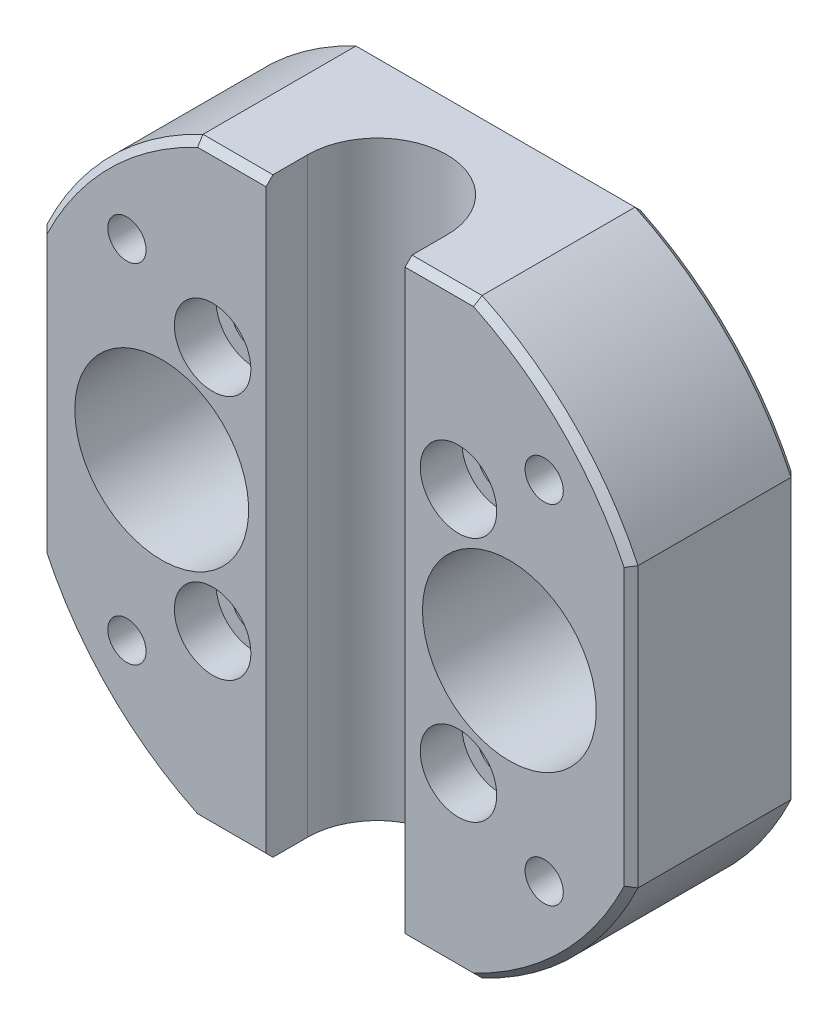
from build123d import *

# Parameters (mm, degrees)
SKETCH1_W                        = 70
SKETCH1_H                        = 50
BOSS_EXTRUDE1_DEPTH              = 12
SKETCH4_R                        = 47
BOSS_EXTRUDE2_DEPTH              = 24
SKETCH2_R                        = 31.5
CUT_EXTRUDE1_DEPTH               = 6
CBORE_START                      = -6
CBORE_FOR_M6_SHCS1_OUTLINE_R     = 3.3
CBORE_FOR_M6_SHCS1_DEPTH         = 18
CBORE_START_2                    = 6
CBORE_FOR_M6_SHCS1_2_OUTLINE_R   = 5.5
CBORE_FOR_M6_SHCS1_2_OUTLINE_R_2 = 3.3
CBORE_FOR_M6_SHCS1_2_DEPTH       = 6
CUT_EXTRUDE6_DEPTH               = 68.542579163
CUT_EXTRUDE6_DEPTH_BACK          = 68.542579163
M5_CLEARANCE_HOLE2_D             = 5.5
F_6_0MM_PRESS_DOWEL_HOLE2_D      = 6
SKETCH22_R                       = 12.5
CUT_EXTRUDE7_DEPTH               = 71.668239144
CUT_EXTRUDE8_DEPTH               = 10
CUT_EXTRUDE9_DEPTH               = 71.668239144
CHAMFER2_SIZE                    = 1


# Read off the part's stored shape, not the designer's step: CBORE for M6 SHCS1
with BuildPart() as part:
    # Sketch1 → Boss-Extrude1 (new, symmetric)
    with BuildSketch(Plane.XY):
        Rectangle(SKETCH1_W, SKETCH1_H)
    extrude(amount=BOSS_EXTRUDE1_DEPTH, both=True)

    # Sketch4 → Boss-Extrude2 (add, through all)
    with BuildSketch(Plane(origin=(0, 0, -12), x_dir=(-1, 0, 0), z_dir=(0, 0, -1))):
        Circle(SKETCH4_R)
    extrude(amount=-BOSS_EXTRUDE2_DEPTH)

    # Sketch2 → Cut-Extrude1 (cut)
    with BuildSketch(Plane(origin=(0, 0, -12), x_dir=(-1, 0, 0), z_dir=(0, 0, -1))):
        Circle(SKETCH2_R)
    extrude(amount=-CUT_EXTRUDE1_DEPTH, mode=Mode.SUBTRACT)

    # CBORE for M6 SHCS1 outline → CBORE for M6 SHCS1 (cut)
    with BuildSketch(Plane.XY.offset(CBORE_START)):
        with Locations((-17.67766953, -17.67766953)):
            Circle(CBORE_FOR_M6_SHCS1_OUTLINE_R)
        with Locations((-17.67766953, 17.67766953)):
            Circle(CBORE_FOR_M6_SHCS1_OUTLINE_R)
        with Locations((17.67766953, 17.67766953)):
            Circle(CBORE_FOR_M6_SHCS1_OUTLINE_R)
        with Locations((17.67766953, -17.67766953)):
            Circle(CBORE_FOR_M6_SHCS1_OUTLINE_R)
    extrude(amount=CBORE_FOR_M6_SHCS1_DEPTH, mode=Mode.SUBTRACT)

    # CBORE for M6 SHCS1 2 outline → CBORE for M6 SHCS1 2 (cut)
    # profile 1 of 4: a face of its own
    with BuildSketch(Plane.XY.offset(CBORE_START_2)):
        with Locations((-17.67766953, -17.67766953)):
            Circle(CBORE_FOR_M6_SHCS1_2_OUTLINE_R)
        with Locations((-17.67766953, -17.67766953)):
            Circle(CBORE_FOR_M6_SHCS1_2_OUTLINE_R_2, mode=Mode.SUBTRACT)
    # profile 2 of 4: a face of its own
    with BuildSketch(Plane.XY.offset(CBORE_START_2)):
        with Locations((-17.67766953, 17.67766953)):
            Circle(CBORE_FOR_M6_SHCS1_2_OUTLINE_R)
        with Locations((-17.67766953, 17.67766953)):
            Circle(CBORE_FOR_M6_SHCS1_2_OUTLINE_R_2, mode=Mode.SUBTRACT)
    # profile 3 of 4: a face of its own
    with BuildSketch(Plane.XY.offset(CBORE_START_2)):
        with Locations((17.67766953, 17.67766953)):
            Circle(CBORE_FOR_M6_SHCS1_2_OUTLINE_R)
        with Locations((17.67766953, 17.67766953)):
            Circle(CBORE_FOR_M6_SHCS1_2_OUTLINE_R_2, mode=Mode.SUBTRACT)
    # profile 4 of 4: a face of its own
    with BuildSketch(Plane.XY.offset(CBORE_START_2)):
        with Locations((17.67766953, -17.67766953)):
            Circle(CBORE_FOR_M6_SHCS1_2_OUTLINE_R)
        with Locations((17.67766953, -17.67766953)):
            Circle(CBORE_FOR_M6_SHCS1_2_OUTLINE_R_2, mode=Mode.SUBTRACT)
    extrude(amount=CBORE_FOR_M6_SHCS1_2_DEPTH, mode=Mode.SUBTRACT)

    # Sketch17 → Cut-Extrude6 (cut, two sides: drawn at the far end of the back side and taken through both)
    with BuildSketch(Plane.XZ.offset(-CUT_EXTRUDE6_DEPTH_BACK)):
        with BuildLine():
            Line((10, 16), (10, 6))
            ThreePointArc((10, 6), (0, -4), (-10, 6))
            Line((-10, 6), (-10, 16))
            ThreePointArc((-10, 16), (0, 26), (10, 16))
        make_face()
    extrude(amount=CUT_EXTRUDE6_DEPTH + CUT_EXTRUDE6_DEPTH_BACK, mode=Mode.SUBTRACT)

    # M5 Clearance Hole2 (through all)
    with Locations(Plane.XY.offset(12)):
        with Locations((-30, 25), (-30, -25), (30, -25), (30, 25)):
            Hole(M5_CLEARANCE_HOLE2_D / 2)

    # Ø6.0mm Press Dowel Hole2 (through all)
    with Locations(Plane.XY.offset(12)):
        with Locations((0, -25)):
            Hole(F_6_0MM_PRESS_DOWEL_HOLE2_D / 2)

    # Sketch22 → Cut-Extrude7 (cut, through all)
    with BuildSketch(Plane(origin=(0, 0, -12), x_dir=(-1, 0, 0), z_dir=(0, 0, -1))):
        with Locations((-25, 0)):
            Circle(SKETCH22_R)
        with Locations((25, 0)):
            Circle(SKETCH22_R)
    extrude(amount=-CUT_EXTRUDE7_DEPTH, mode=Mode.SUBTRACT)

    # Sketch23 → Cut-Extrude8 (cut)
    with BuildSketch(Plane(origin=(0, 0, -12), x_dir=(-1, 0, 0), z_dir=(0, 0, -1))):
        Polygon((-27.690598923, 29), (-32.309401077, 29), (-34.618802154, 25), (-32.309401077, 21), (-27.690598923, 21), (-25.381197846, 25), align=None)
        Polygon((-32.309401077, -21), (-34.618802154, -25), (-32.309401077, -29), (-27.690598923, -29), (-25.381197846, -25), (-27.690598923, -21), align=None)
        Polygon((32.309401077, -21), (27.690598923, -21), (25.381197846, -25), (27.690598923, -29), (32.309401077, -29), (34.618802154, -25), align=None)
        Polygon((27.690598923, 29), (25.381197846, 25), (27.690598923, 21), (32.309401077, 21), (34.618802154, 25), (32.309401077, 29), align=None)
    extrude(amount=-CUT_EXTRUDE8_DEPTH, mode=Mode.SUBTRACT)

    # Sketch24 → Cut-Extrude9 (cut, through all)
    with BuildSketch(Plane.XY.offset(12)):
        with BuildLine():
            ThreePointArc((-20.06863224, -42.5), (-15.131468813, -44.497625235), (-10, -45.923850013))
            Line((-10, -45.923850013), (-10, -42.5))
            Line((-10, -42.5), (-20.06863224, -42.5))
        make_face()
        with BuildLine():
            Line((-10, -42.5), (-10, -45.923850013))
            ThreePointArc((-10, -45.923850013), (0, -47), (10, -45.923850013))
            Line((10, -45.923850013), (10, -42.5))
            Line((10, -42.5), (-10, -42.5))
        make_face()
        with BuildLine():
            Line((10, -42.5), (10, -45.923850013))
            ThreePointArc((10, -45.923850013), (15.131468813, -44.497625235), (20.06863224, -42.5))
            Line((20.06863224, -42.5), (10, -42.5))
        make_face()
        with BuildLine():
            Line((42.5, 20.06863224), (42.5, -20.06863224))
            ThreePointArc((42.5, -20.06863224), (47, 0), (42.5, 20.06863224))
        make_face()
        with BuildLine():
            Line((10, 45.923850013), (10, 42.5))
            Line((10, 42.5), (20.06863224, 42.5))
            ThreePointArc((20.06863224, 42.5), (15.131468813, 44.497625235), (10, 45.923850013))
        make_face()
        with BuildLine():
            Line((-10, 45.923850013), (-10, 42.5))
            Line((-10, 42.5), (10, 42.5))
            Line((10, 42.5), (10, 45.923850013))
            ThreePointArc((10, 45.923850013), (0, 47), (-10, 45.923850013))
        make_face()
        with BuildLine():
            Line((-20.06863224, 42.5), (-10, 42.5))
            Line((-10, 42.5), (-10, 45.923850013))
            ThreePointArc((-10, 45.923850013), (-15.131468813, 44.497625235), (-20.06863224, 42.5))
        make_face()
        with BuildLine():
            ThreePointArc((-42.5, 20.06863224), (-47, 0), (-42.5, -20.06863224))
            Line((-42.5, -20.06863224), (-42.5, 20.06863224))
        make_face()
    extrude(amount=-CUT_EXTRUDE9_DEPTH, mode=Mode.SUBTRACT)

    # Chamfer2
    chamfer2_edges = [part.edges().sort_by_distance(p)[0] for p in [
        (-33.234018716, 33.234018716, -12),
        (-33.234018716, -33.234018716, 12),
        (-33.234018716, 33.234018716, 12),
        (33.234018716, 33.234018716, -12),
        (33.234018716, -33.234018716, -12),
        (-33.234018716, -33.234018716, -12),
        (33.234018716, 33.234018716, 12),
        (33.234018716, -33.234018716, 12),
        (0, -42.5, -12),
        (15.03431612, -42.5, 12),
        (-15.03431612, -42.5, 12),
        (42.5, 0, 12),
        (42.5, 0, -12),
        (-15.03431612, 42.5, 12),
        (15.03431612, 42.5, 12),
        (0, 42.5, -12),
        (-42.5, 0, -12),
        (-42.5, 0, 12),
    ]]
    chamfer(chamfer2_edges, length=CHAMFER2_SIZE)


solid = part.part
